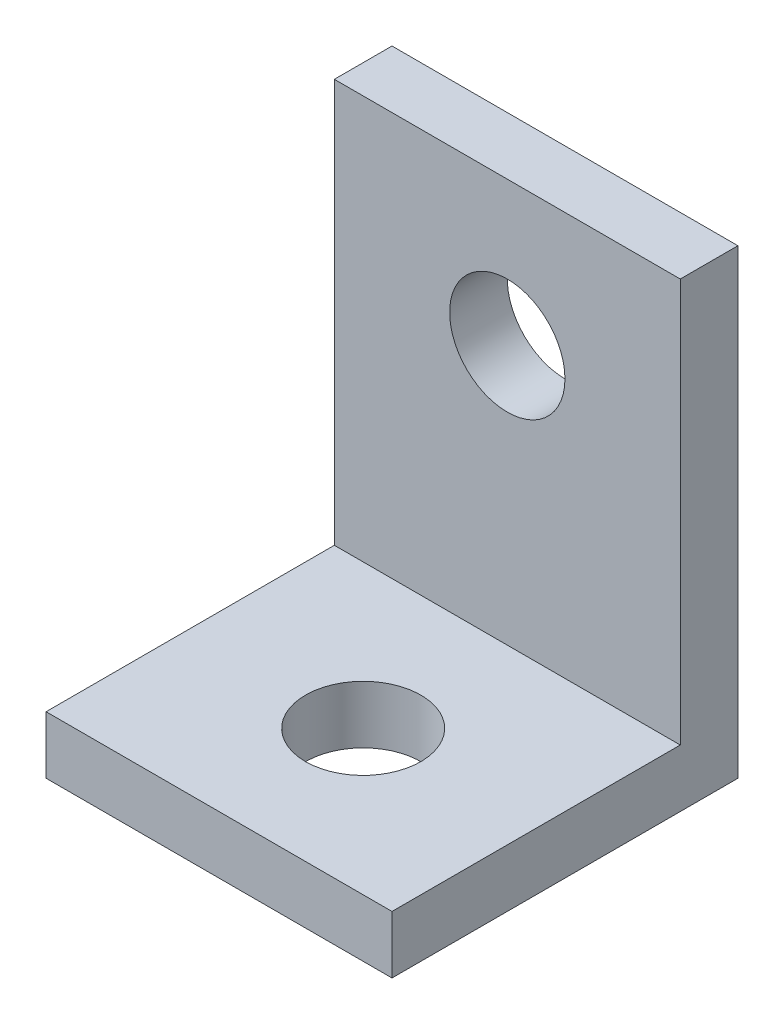
from build123d import *

# Parameters (mm, degrees)
SKETCH1_W           = 19.05
SKETCH1_H           = 19.05
BOSS_EXTRUDE1_DEPTH = 3.175
SKETCH2_W           = 19.05
SKETCH2_H           = 3.175
BOSS_EXTRUDE2_DEPTH = 22.225
CUT_EXTRUDE1_REACH  = 36.925
SKETCH3_R           = 3.175
CUT_EXTRUDE2_REACH  = 37.498
SKETCH4_R           = 3.175


with BuildPart() as part:
    # Sketch1 → Boss-Extrude1 (new body)
    with BuildSketch(Plane(origin=(0, 0, 0), x_dir=(1, 0, 0), z_dir=(0, 1, 0))):
        with Locations((9.525, -9.525)):
            Rectangle(SKETCH1_W, SKETCH1_H)
    extrude(amount=BOSS_EXTRUDE1_DEPTH)

    # Sketch2 → Boss-Extrude2 (add)
    with BuildSketch(Plane(origin=(0, 3.175, 0), x_dir=(1, 0, 0), z_dir=(0, 1, 0))):
        with Locations((9.525, -1.5875)):
            Rectangle(SKETCH2_W, SKETCH2_H)
    extrude(amount=BOSS_EXTRUDE2_DEPTH)

    # Sketch3 → Cut-Extrude1 (cut, up to next)
    with BuildSketch(Plane(origin=(0, 3.175, 0), x_dir=(1, 0, 0), z_dir=(0, 1, 0)), mode=Mode.PRIVATE) as cut_extrude1_sk1:
        with Locations((9.525, -11.1125)):
            Circle(SKETCH3_R)
    cut_extrude1_tool1 = extrude(cut_extrude1_sk1.sketch, amount=-CUT_EXTRUDE1_REACH, mode=Mode.PRIVATE) & part.part
    add(cut_extrude1_tool1.solids().sort_by_distance((9.525, 3.175, 11.1125))[0], mode=Mode.SUBTRACT)

    # Sketch4 → Cut-Extrude2 (cut, up to next)
    with BuildSketch(Plane.XY.offset(3.175), mode=Mode.PRIVATE) as cut_extrude2_sk1:
        with Locations((9.525, 17.4625)):
            Circle(SKETCH4_R)
    cut_extrude2_tool1 = extrude(cut_extrude2_sk1.sketch, amount=-CUT_EXTRUDE2_REACH, mode=Mode.PRIVATE) & part.part
    add(cut_extrude2_tool1.solids().sort_by_distance((9.525, 17.4625, 3.175))[0], mode=Mode.SUBTRACT)


solid = part.part
